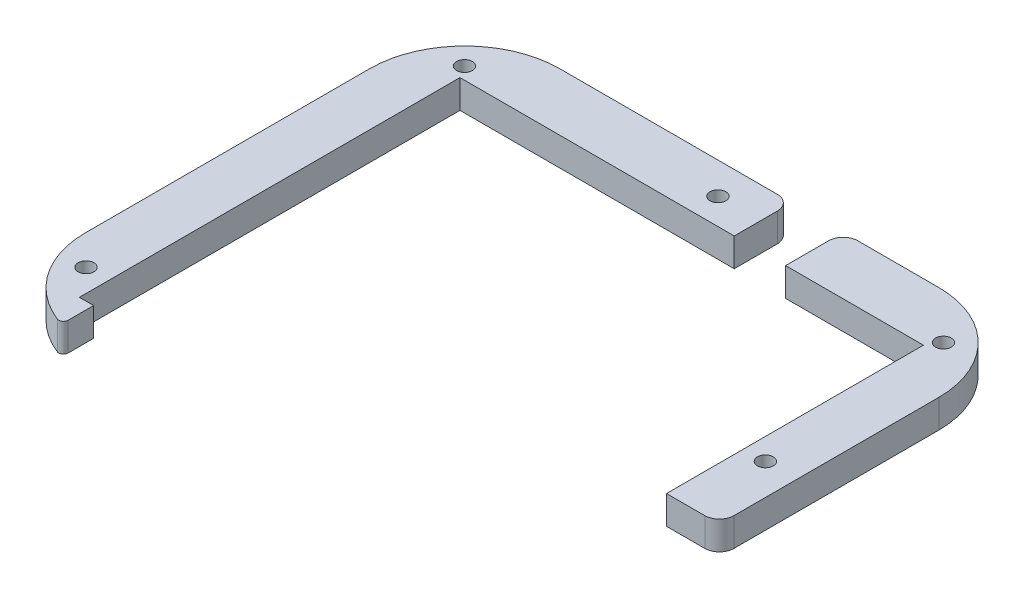
from build123d import *

# Parameters (mm, degrees)
BOSS_EXTRUDE1_DEPTH    = 6
CUT_EXTRUDE1_DEPTH     = 79.33262411
SKETCH3_W              = 25
SKETCH3_H              = 31.620571099
CUT_EXTRUDE2_DEPTH     = 79.33262411
FILLET1_R              = 3
SKETCH4_W              = 11
SKETCH4_H              = 12
CUT_EXTRUDE3_DEPTH     = 79.33262411
FILLET2_R              = 3
FILLET3_R              = 3
SKETCH5_R              = 1.75
CUT_EXTRUDE4_DEPTH     = 79.33262411
MOVE_FACE2_BY          = 0.08
MOVE_FACE2_2_BY        = 0.08
MOVE_FACE2_3_BY        = 0.08
MOVE_FACE2_4_BY        = 0.08
MOVE_FACE2_5_BY        = 0.08
MOVE_FACE2_6_BY        = 0.08
MOVE_FACE2_7_BY        = 0.08
MOVE_FACE2_8_BY        = 0.08
MOVE_FACE2_9_BY        = 0.08
MOVE_FACE2_10_BY       = 0.08
MOVE_FACE2_11_BY       = 0.08
MOVE_FACE3_OUTLINE_R   = 1.75
MOVE_FACE3_OUTLINE_R_2 = 1.67
MOVE_FACE3_DEPTH       = 6
FILLET4_R              = 1


# Read off the part's stored shape, not the designer's step: Move Face3
with BuildPart() as part:
    # Sketch1 → Boss-Extrude1 (new body)
    with BuildSketch(Plane(origin=(0, 0, 0), x_dir=(1, 0, 0), z_dir=(0, 1, 0))):
        with BuildLine():
            Line((-60, 30), (-60, -30))
            ThreePointArc((-60, -30), (-54.142135624, -44.142135624), (-40, -50))
            Line((-40, -50), (40, -50))
            ThreePointArc((40, -50), (54.142135624, -44.142135624), (60, -30))
            Line((60, -30), (60, 30))
            ThreePointArc((60, 30), (54.142135624, 44.142135624), (40, 50))
            Line((40, 50), (-40, 50))
            ThreePointArc((-40, 50), (-54.142135624, 44.142135624), (-60, 30))
        make_face()
    extrude(amount=BOSS_EXTRUDE1_DEPTH)

    # Sketch2 → Cut-Extrude1 (cut, through all)
    with BuildSketch(Plane(origin=(0, 6, 0), x_dir=(1, 0, 0), z_dir=(0, 1, 0))):
        Polygon((-49, 38), (49, 38), (49, -50), (-46, -50), (-46, -42.5), (-49, -42.5), align=None)
    extrude(amount=-CUT_EXTRUDE1_DEPTH, mode=Mode.SUBTRACT)

    # Sketch3 → Cut-Extrude2 (cut, through all)
    with BuildSketch(Plane(origin=(0, 6, 0), x_dir=(1, 0, 0), z_dir=(0, 1, 0))):
        with Locations((61.5, -32.05028555)):
            Rectangle(SKETCH3_W, SKETCH3_H)
    extrude(amount=-CUT_EXTRUDE2_DEPTH, mode=Mode.SUBTRACT)

    # Fillet1
    fillet1_edges = [part.edges().sort_by_distance(p)[0] for p in [
        (60, 3, 16.24),
    ]]
    fillet(fillet1_edges, radius=FILLET1_R)

    # Sketch4 → Cut-Extrude3 (cut, through all)
    with BuildSketch(Plane(origin=(0, 6, 0), x_dir=(1, 0, 0), z_dir=(0, 1, 0))):
        with Locations((14.4, 44)):
            Rectangle(SKETCH4_W, SKETCH4_H)
    extrude(amount=-CUT_EXTRUDE3_DEPTH, mode=Mode.SUBTRACT)


with BuildPart() as cut_extrude3_piece_1:
    # of the separate pieces the step leaves, piece 1, a body of its own (cut_extrude3_pieces)
    add(part.part.solids().sort_by_distance((8.9, 0, -50))[0])

    # Fillet2
    fillet2_edges = [cut_extrude3_piece_1.edges().sort_by_distance(p)[0] for p in [
        (8.9, 3, -50),
    ]]
    fillet(fillet2_edges, radius=FILLET2_R)


with BuildPart() as cut_extrude3_piece_2:
    # of the separate pieces the step leaves, piece 2, a body of its own (cut_extrude3_pieces)
    add(part.part.solids().sort_by_distance((60, 0, 13.24))[0])

    # Fillet3
    fillet3_edges = [cut_extrude3_piece_2.edges().sort_by_distance(p)[0] for p in [
        (19.9, 3, -50),
    ]]
    fillet(fillet3_edges, radius=FILLET3_R)


with BuildPart() as cut_extrude4_tool:
    # Sketch5 → Cut-Extrude4 (new, through all)
    with BuildSketch(Plane(origin=(0, 6, 0), x_dir=(1, 0, 0), z_dir=(0, 1, 0))):
        with Locations(Location((53.475, 0, 0), (0, 0, 270))):
            Circle(SKETCH5_R)
        with Locations(Location((-53.709292606, -36.227375296, 0), (0, 0, 270))):
            Circle(SKETCH5_R)
        with Locations(Location((0, 43.45, 0), (0, 0, 270))):
            Circle(SKETCH5_R)
        with Locations(Location((50.558556763, 40.508556763, 0), (0, 0, 270))):
            Circle(SKETCH5_R)
        with Locations(Location((-50.558556763, 40.508556763, 0), (0, 0, 90))):
            Circle(SKETCH5_R)
    extrude(amount=-CUT_EXTRUDE4_DEPTH)


with BuildPart() as cut_extrude3_piece_1_1:
    add(cut_extrude3_piece_1.part)

    # Cut-Extrude4: cut by cut_extrude4_tool
    add(cut_extrude4_tool.part, mode=Mode.SUBTRACT)

    # Move Face3 outline → Move Face3 (add)
    # profile 1 of 4: a face of its own
    with BuildSketch(Plane(origin=(0, 0, 0), x_dir=(1, 0, 0), z_dir=(0, 1, 0))):
        with BuildLine():
            Line((5.9, 50.08), (-40, 50.08))
            ThreePointArc((-40, 50.08), (-54.198704166, 44.198704166), (-60.08, 30))
            Line((-60.08, 30), (-60.08, -30))
            ThreePointArc((-60.08, -30), (-56.156732343, -41.923355232), (-45.92, -49.187495928))
            Line((-45.92, -49.187495928), (-45.92, -42.42))
            Line((-45.92, -42.42), (-48.92, -42.42))
            Line((-48.92, -42.42), (-48.92, 37.92))
            Line((-48.92, 37.92), (8.98, 37.92))
            Line((8.98, 37.92), (8.98, 47))
            ThreePointArc((8.98, 47), (8.077888886, 49.177888886), (5.9, 50.08))
        make_face()
        with BuildLine():
            Line((-60, -30), (-60, 30))
            ThreePointArc((-60, 30), (-54.142135624, 44.142135624), (-40, 50))
            Line((-40, 50), (5.9, 50))
            ThreePointArc((5.9, 50), (8.021320344, 49.121320344), (8.9, 47))
            Line((8.9, 47), (8.9, 38))
            Line((8.9, 38), (-49, 38))
            Line((-49, 38), (-49, -42.5))
            Line((-49, -42.5), (-46, -42.5))
            Line((-46, -42.5), (-46, -49.078784028))
            ThreePointArc((-46, -49.078784028), (-56.124515497, -41.832159566), (-60, -30))
        make_face(mode=Mode.SUBTRACT)
    # profile 2 of 4: a face of its own
    with BuildSketch(Plane(origin=(0, 0, 0), x_dir=(1, 0, 0), z_dir=(0, 1, 0))):
        with Locations((-53.709292606, -36.227375296)):
            Circle(MOVE_FACE3_OUTLINE_R)
        with Locations((-53.709292606, -36.227375296)):
            Circle(MOVE_FACE3_OUTLINE_R_2, mode=Mode.SUBTRACT)
    # profile 3 of 4: a face of its own
    with BuildSketch(Plane(origin=(0, 0, 0), x_dir=(1, 0, 0), z_dir=(0, 1, 0))):
        with Locations((-50.558556763, 40.508556763)):
            Circle(MOVE_FACE3_OUTLINE_R)
        with Locations((-50.558556763, 40.508556763)):
            Circle(MOVE_FACE3_OUTLINE_R_2, mode=Mode.SUBTRACT)
    # profile 4 of 4: a face of its own
    with BuildSketch(Plane(origin=(0, 0, 0), x_dir=(1, 0, 0), z_dir=(0, 1, 0))):
        with Locations((0, 43.45)):
            Circle(MOVE_FACE3_OUTLINE_R)
        with Locations((0, 43.45)):
            Circle(MOVE_FACE3_OUTLINE_R_2, mode=Mode.SUBTRACT)
    extrude(amount=MOVE_FACE3_DEPTH)

    # Fillet4
    fillet4_edges = [cut_extrude3_piece_1_1.edges().sort_by_distance(p)[0] for p in [
        (-45.92, 3, 49.187495928),
    ]]
    fillet(fillet4_edges, radius=FILLET4_R)


with BuildPart() as cut_extrude3_piece_2_1:
    add(cut_extrude3_piece_2.part)

    # Cut-Extrude4: cut by cut_extrude4_tool
    add(cut_extrude4_tool.part, mode=Mode.SUBTRACT)

    # Move Face2: a curved face moved outward by 0.08
    add(Solid.thicken(cut_extrude3_piece_2_1.faces().sort_by_distance((50.558556763, 3, -42.258556763))[0], MOVE_FACE2_BY))

    # Move Face2 2: a curved face moved outward by 0.08
    add(Solid.thicken(cut_extrude3_piece_2_1.faces().sort_by_distance((53.475, 3, -1.75))[0], MOVE_FACE2_2_BY))

    # Move Face2 3: a face moved outward by 0.08
    extrude(cut_extrude3_piece_2_1.faces().sort_by_distance((19.9, 3, -42.5))[0], amount=MOVE_FACE2_3_BY, dir=(-1, 0, 0))

    # Move Face2 4: a curved face moved outward by 0.08
    add(Solid.thicken(cut_extrude3_piece_2_1.faces().sort_by_distance((20.778679656, 3, -49.121320344))[0], MOVE_FACE2_4_BY))

    # Move Face2 5: a face moved outward by 0.08
    extrude(cut_extrude3_piece_2_1.faces().sort_by_distance((31.45, 3, -50))[0], amount=MOVE_FACE2_5_BY, dir=(0, 0, -1))

    # Move Face2 6: a curved face moved outward by 0.08
    add(Solid.thicken(cut_extrude3_piece_2_1.faces().sort_by_distance((54.142135624, 3, -44.142135624))[0], MOVE_FACE2_6_BY))

    # Move Face2 7: a face moved outward by 0.08
    extrude(cut_extrude3_piece_2_1.faces().sort_by_distance((60, 3, -8.38))[0], amount=MOVE_FACE2_7_BY, dir=(1, 0, 0))

    # Move Face2 8: a curved face moved outward by 0.08
    add(Solid.thicken(cut_extrude3_piece_2_1.faces().sort_by_distance((59.121320344, 3, 15.361320344))[0], MOVE_FACE2_8_BY))

    # Move Face2 9: a face moved outward by 0.08
    extrude(cut_extrude3_piece_2_1.faces().sort_by_distance((49, 3, -10.88))[0], amount=MOVE_FACE2_9_BY, dir=(-1, 0, 0))

    # Move Face2 10: a face moved outward by 0.08
    extrude(cut_extrude3_piece_2_1.faces().sort_by_distance((34.45, 3, -38))[0], amount=MOVE_FACE2_10_BY, dir=(0, 0, 1))

    # Move Face2 11: a face moved outward by 0.08
    extrude(cut_extrude3_piece_2_1.faces().sort_by_distance((53, 3, 16.24))[0], amount=MOVE_FACE2_11_BY, dir=(0, 0, 1))


solid = Compound([cut_extrude3_piece_1_1.part, cut_extrude3_piece_2_1.part])
